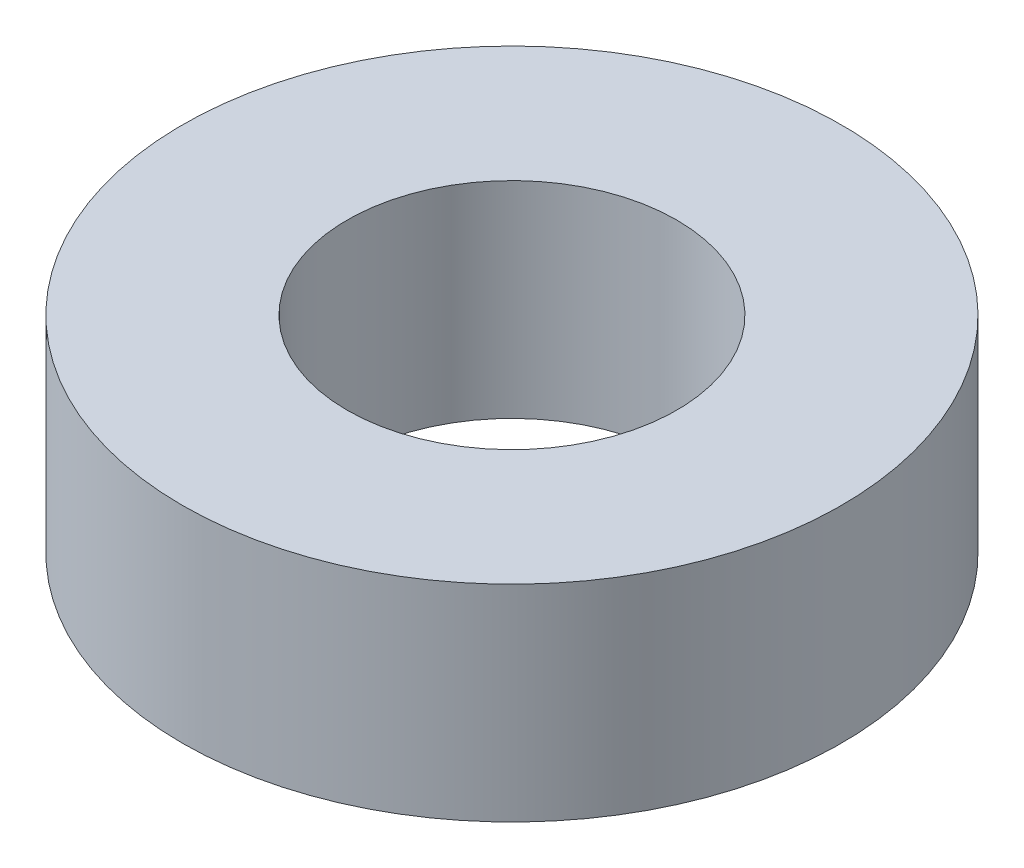
from build123d import *

# Parameters (mm, degrees)
SKETCH1_R           = 4
SKETCH1_R_2         = 2
BOSS_EXTRUDE1_DEPTH = 2.5


with BuildPart() as part:
    # Sketch1 → Boss-Extrude1 (new body)
    with BuildSketch(Plane(origin=(0, 0, 0), x_dir=(1, 0, 0), z_dir=(0, 1, 0))):
        Circle(SKETCH1_R)
        Circle(SKETCH1_R_2, mode=Mode.SUBTRACT)
    extrude(amount=BOSS_EXTRUDE1_DEPTH)


solid = part.part
